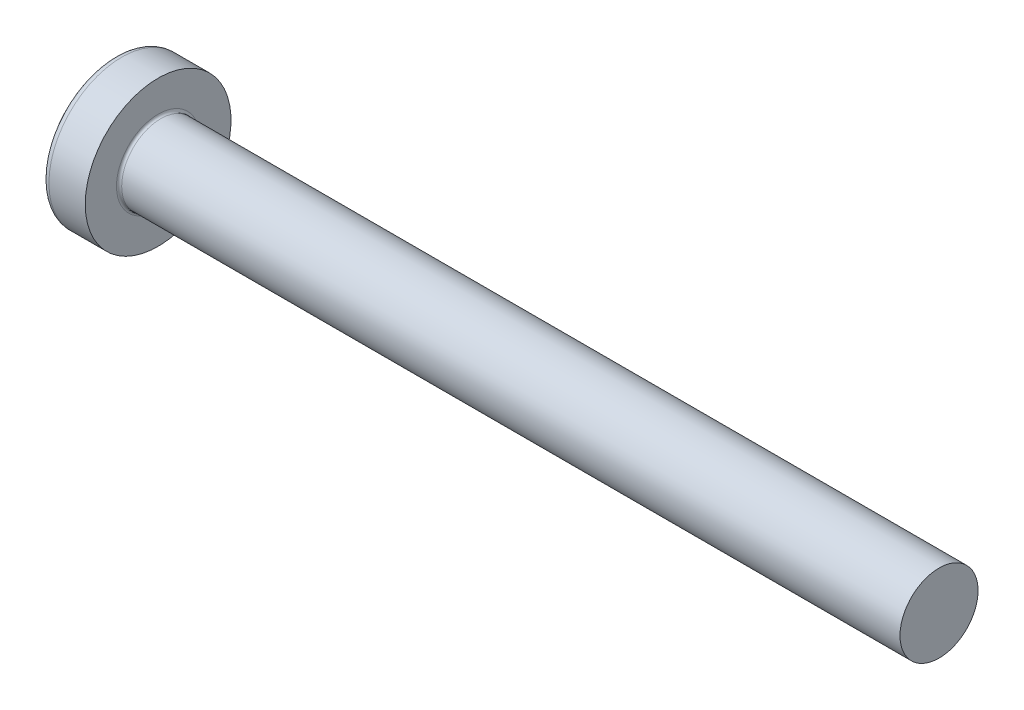
from build123d import *

# Parameters (mm, degrees)
RECPAT_COUNT = 2
RECPAT_ANGLE = 90


with BuildPart() as part:
    # Fillet1: read off the stored shape, not the designer's step
    # Fillet1 outline → Fillet1 (revolve)
    with BuildSketch(Plane.YX):
        with BuildLine():
            Line((1.5, 2.5), (1.5, 32.4))
            Line((1.5, 32.4), (0, 32.4))
            Line((0, 32.4), (0, 0))
            ThreePointArc((0, 0), (1.392274758, 0.197753547), (2.674418607, 0.775371601))
            ThreePointArc((2.674418607, 0.775371601), (2.76653015, 0.873295971), (2.8, 1.003501533))
            Line((2.8, 1.003501533), (2.8, 2.4))
            Line((2.8, 2.4), (1.6, 2.4))
            ThreePointArc((1.6, 2.4), (1.529289322, 2.429289322), (1.5, 2.5))
        make_face()
    revolve(axis=Axis((0, 0, 0), (1, 0, 0)))

    # Sketch3 → Recess section 0
    with BuildSketch(Plane(origin=(0, 0, 0), x_dir=(0, 0, -1), z_dir=(1, 0, 0))):
        with BuildLine():
            Line((0.37, -1.4), (-0.37, -1.4))
            Line((-0.37, -1.4), (-0.37, 1.4))
            Line((-0.37, 1.4), (0.37, 1.4))
            Line((0.37, 1.4), (0.37, -1.4))
        make_face()
    # Sketch4 → Recess section 1
    with BuildSketch(Plane(origin=(1.75, 0, 0), x_dir=(0, 0, -1), z_dir=(1, 0, 0))):
        with BuildLine():
            Line((0.37, -0.527482332), (-0.37, -0.527482332))
            Line((-0.37, -0.527482332), (-0.37, 0.527482332))
            Line((-0.37, 0.527482332), (0.37, 0.527482332))
            Line((0.37, 0.527482332), (0.37, -0.527482332))
        make_face()
    recess = loft(mode=Mode.SUBTRACT)

    # RecPat: Recess ×2 about axis
    recpat_axis = Axis((0, 0, 0), (1, 0, 0))
    for i in range(1, RECPAT_COUNT):
        add(recess.rotate(recpat_axis, i * RECPAT_ANGLE / (RECPAT_COUNT - 1)), mode=Mode.SUBTRACT)

    # RecCorSke → RecessCore (revolve, cut)
    with BuildSketch(Plane.XY, mode=Mode.PRIVATE) as recesscore_sk:
        Polygon((0, 0), (0, 0.678371921), (1.75, 0.556), (1.930655351, 0), align=None)
    revolve(recesscore_sk.sketch.rotate(Axis((-3.175, 0, 0), (1, 0, 0)), 90), axis=Axis((-3.175, 0, 0), (1, 0, 0)), mode=Mode.SUBTRACT)


solid = part.part
